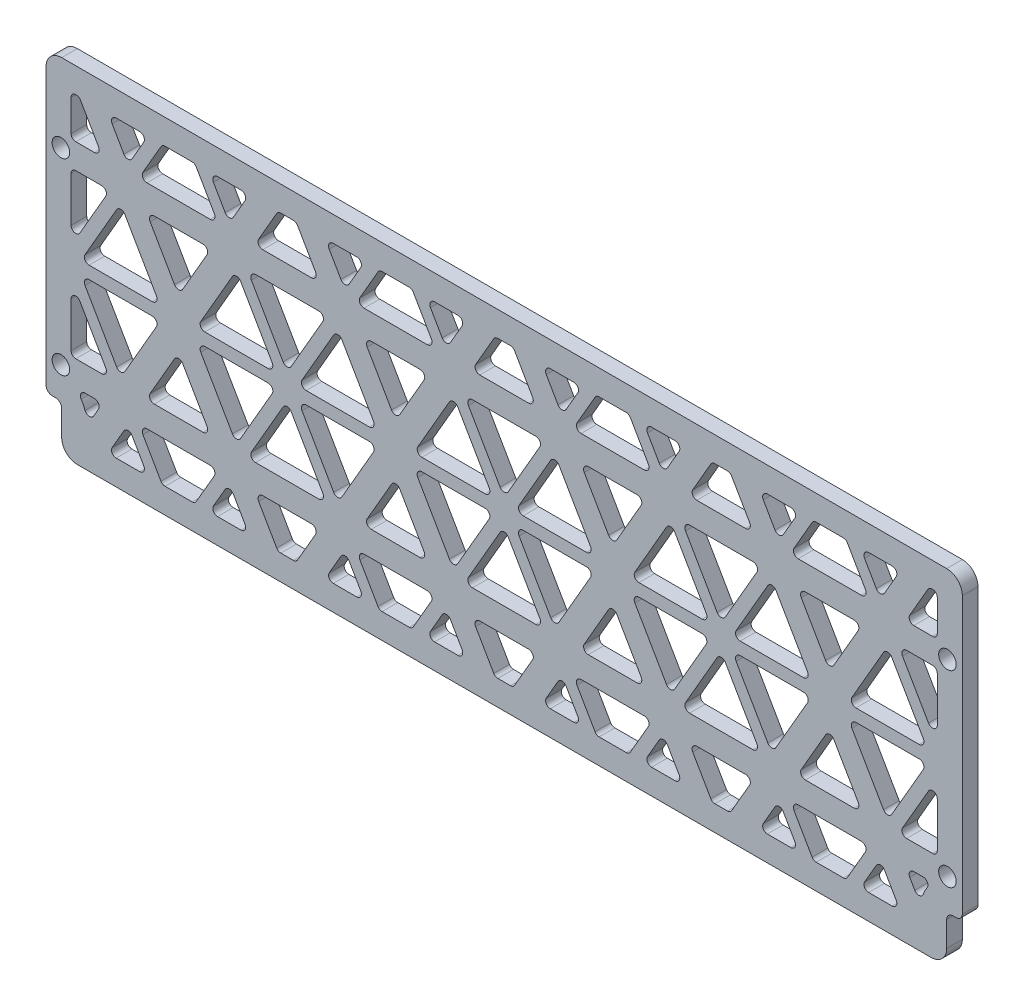
from build123d import *

# Parameters (mm, degrees)
SKETCH1_R           = 3.556
BOSS_EXTRUDE1_DEPTH = 6.35
CUT_EXTRUDE2_DEPTH  = 233.496949241
FILLET1_R           = 1.905


with BuildPart() as part:
    # Sketch1 → Boss-Extrude1 (new body)
    with BuildSketch(Plane.XY):
        with BuildLine():
            Line((-185.7375, 133.35), (-185.7375, 21.59))
            ThreePointArc((-185.7375, 21.59), (-184.993551224, 19.793948776), (-183.1975, 19.05))
            Line((-183.1975, 19.05), (-181.9275, 19.05))
            ThreePointArc((-181.9275, 19.05), (-180.131448776, 18.306051224), (-179.3875, 16.51))
            Line((-179.3875, 16.51), (-179.3875, 6.35))
            ThreePointArc((-179.3875, 6.35), (-177.527628061, 1.859871939), (-173.0375, 0))
            Line((-173.0375, 0), (173.0375, 0))
            ThreePointArc((173.0375, 0), (177.527628061, 1.859871939), (179.3875, 6.35))
            Line((179.3875, 6.35), (179.3875, 16.51))
            ThreePointArc((179.3875, 16.51), (180.131448776, 18.306051224), (181.9275, 19.05))
            Line((181.9275, 19.05), (183.1975, 19.05))
            ThreePointArc((183.1975, 19.05), (184.993551224, 19.793948776), (185.7375, 21.59))
            Line((185.7375, 21.59), (185.7375, 133.35))
            ThreePointArc((185.7375, 133.35), (183.877628061, 137.840128061), (179.3875, 139.7))
            Line((179.3875, 139.7), (-179.3875, 139.7))
            ThreePointArc((-179.3875, 139.7), (-183.877628061, 137.840128061), (-185.7375, 133.35))
        make_face()
        with Locations((-179.705, 31.75)):
            Circle(SKETCH1_R, mode=Mode.SUBTRACT)
        with Locations((-179.705, 107.95)):
            Circle(SKETCH1_R, mode=Mode.SUBTRACT)
        with Locations((179.705, 107.95)):
            Circle(SKETCH1_R, mode=Mode.SUBTRACT)
        with Locations((179.705, 31.75)):
            Circle(SKETCH1_R, mode=Mode.SUBTRACT)
    extrude(amount=BOSS_EXTRUDE1_DEPTH)

    # Sketch4 → Cut-Extrude2 (cut, through all)
    with BuildSketch(Plane.XY.offset(6.35)):
        Polygon((-175.5775, 102.87), (-175.5775, 75.620849334), (-159.845195528, 102.87), align=None)
        Polygon((-155.445786477, 100.33), (-171.576952998, 72.39), (-139.314619955, 72.39), align=None)
        Polygon((-159.845195528, 36.83), (-175.5775, 64.079150666), (-175.5775, 36.83), align=None)
        Polygon((-139.314619955, 67.31), (-171.576952998, 67.31), (-155.445786477, 39.37), align=None)
        Polygon((-175.5775, 129.54), (-175.5775, 113.03), (-162.778134895, 113.03), (-172.31018784, 129.54), align=None)
        Polygon((-118.784044383, 102.87), (-145.18049869, 102.87), (-131.982271537, 80.01), align=None)
        with BuildLine():
            Line((-162.778134895, 26.67), (-174.3075, 26.67))
            ThreePointArc((-174.3075, 26.67), (-170.568274674, 22.189612663), (-169.2275, 16.51))
            Line((-169.2275, 16.51), (-169.2275, 15.499371962))
            Line((-169.2275, 15.499371962), (-162.778134895, 26.67))
        make_face()
        Polygon((-118.784044383, 36.83), (-131.982271537, 59.69), (-145.18049869, 36.83), align=None)
        Polygon((-108.518756597, 100.33), (-124.649923118, 72.39), (-92.387590076, 72.39), align=None)
        Polygon((-92.387590076, 67.31), (-124.649923118, 67.31), (-108.518756597, 39.37), align=None)
        Polygon((-144.447263849, 129.54), (-160.57843037, 129.54), (-152.512847109, 115.57), align=None)
        Polygon((-138.581385114, 129.54), (-148.113438058, 113.03), (-115.851105016, 113.03), (-125.38315796, 129.54), align=None)
        Polygon((-144.447263849, 10.16), (-152.512847109, 24.13), (-160.57843037, 10.16), align=None)
        Polygon((-115.851105016, 26.67), (-148.113438058, 26.67), (-138.581385114, 10.16), (-125.38315796, 10.16), align=None)
        Polygon((-71.857014503, 102.87), (-104.119347546, 102.87), (-87.988181024, 74.93), align=None)
        Polygon((-119.517279225, 129.54), (-111.451695964, 115.57), (-103.386112704, 129.54), align=None)
        Polygon((-103.386112704, 10.16), (-111.451695964, 24.13), (-119.517279225, 10.16), align=None)
        Polygon((-87.988181024, 64.77), (-104.119347546, 36.83), (-71.857014503, 36.83), align=None)
        Polygon((-91.654355234, 129.54), (-101.186408178, 113.03), (-74.789953871, 113.03), (-84.322006815, 129.54), align=None)
        Polygon((-67.457605452, 100.33), (-83.588771973, 72.39), (-51.326438931, 72.39), align=None)
        Polygon((-74.789953871, 26.67), (-101.186408178, 26.67), (-91.654355234, 10.16), (-84.322006815, 10.16), align=None)
        Polygon((-51.326438931, 67.31), (-83.588771973, 67.31), (-67.457605452, 39.37), align=None)
        Polygon((-30.795863359, 102.87), (-57.192317666, 102.87), (-43.994090512, 80.01), align=None)
        Polygon((-56.459082824, 129.54), (-72.590249345, 129.54), (-64.524666085, 115.57), align=None)
        Polygon((-56.459082824, 10.16), (-64.524666085, 24.13), (-72.590249345, 10.16), align=None)
        Polygon((-43.994090512, 59.69), (-57.192317666, 36.83), (-30.795863359, 36.83), align=None)
        Polygon((-50.593204089, 129.54), (-60.125257033, 113.03), (-27.862923991, 113.03), (-37.394976935, 129.54), align=None)
        Polygon((-20.530575572, 100.33), (-36.661742094, 72.39), (-4.399409051, 72.39), align=None)
        Polygon((-27.862923991, 26.67), (-60.125257033, 26.67), (-50.593204089, 10.16), (-37.394976935, 10.16), align=None)
        Polygon((-4.399409051, 67.31), (-36.661742094, 67.31), (-20.530575572, 39.37), align=None)
        Polygon((-15.397931679, 129.54), (-31.5290982, 129.54), (-23.46351494, 115.57), align=None)
        Polygon((-23.46351494, 24.13), (-31.5290982, 10.16), (-15.397931679, 10.16), align=None)
        Polygon((16.131166521, 102.87), (-16.131166521, 102.87), (0, 74.93), align=None)
        Polygon((0, 64.77), (-16.131166521, 36.83), (16.131166521, 36.83), align=None)
        Polygon((-3.666174209, 129.54), (-13.198227154, 113.03), (13.198227154, 113.03), (3.666174209, 129.54), align=None)
        Polygon((20.530575572, 100.33), (4.399409051, 72.39), (36.661742094, 72.39), align=None)
        Polygon((13.198227154, 26.67), (-13.198227154, 26.67), (-3.666174209, 10.16), (3.666174209, 10.16), align=None)
        Polygon((36.661742094, 67.31), (4.399409051, 67.31), (20.530575572, 39.37), align=None)
        Polygon((31.5290982, 129.54), (15.397931679, 129.54), (23.46351494, 115.57), align=None)
        Polygon((23.46351494, 24.13), (15.397931679, 10.16), (31.5290982, 10.16), align=None)
        Polygon((57.192317666, 102.87), (30.795863359, 102.87), (43.994090512, 80.01), align=None)
        Polygon((43.994090512, 59.69), (30.795863359, 36.83), (57.192317666, 36.83), align=None)
        Polygon((37.394976935, 129.54), (27.862923991, 113.03), (60.125257033, 113.03), (50.593204089, 129.54), align=None)
        Polygon((67.457605452, 100.33), (51.326438931, 72.39), (83.588771973, 72.39), align=None)
        Polygon((60.125257033, 26.67), (27.862923991, 26.67), (37.394976935, 10.16), (50.593204089, 10.16), align=None)
        Polygon((83.588771973, 67.31), (51.326438931, 67.31), (67.457605452, 39.37), align=None)
        Polygon((72.590249345, 129.54), (56.459082824, 129.54), (64.524666085, 115.57), align=None)
        Polygon((64.524666085, 24.13), (56.459082824, 10.16), (72.590249345, 10.16), align=None)
        Polygon((104.119347546, 102.87), (71.857014503, 102.87), (87.988181024, 74.93), align=None)
        Polygon((91.654355234, 129.54), (84.322006815, 129.54), (74.789953871, 113.03), (101.186408178, 113.03), align=None)
        Polygon((74.789953871, 26.67), (84.322006815, 10.16), (91.654355234, 10.16), (101.186408178, 26.67), align=None)
        Polygon((87.988181024, 64.77), (71.857014503, 36.83), (104.119347546, 36.83), align=None)
        Polygon((108.518756597, 100.33), (92.387590076, 72.39), (124.649923118, 72.39), align=None)
        Polygon((124.649923118, 67.31), (92.387590076, 67.31), (108.518756597, 39.37), align=None)
        Polygon((119.517279225, 129.54), (103.386112704, 129.54), (111.451695964, 115.57), align=None)
        Polygon((111.451695964, 24.13), (103.386112704, 10.16), (119.517279225, 10.16), align=None)
        Polygon((145.18049869, 102.87), (118.784044383, 102.87), (131.982271537, 80.01), align=None)
        Polygon((138.581385114, 129.54), (125.38315796, 129.54), (115.851105016, 113.03), (148.113438058, 113.03), align=None)
        Polygon((115.851105016, 26.67), (125.38315796, 10.16), (138.581385114, 10.16), (148.113438058, 26.67), align=None)
        Polygon((131.982271537, 59.69), (118.784044383, 36.83), (145.18049869, 36.83), align=None)
        Polygon((160.57843037, 129.54), (144.447263849, 129.54), (152.512847109, 115.57), align=None)
        Polygon((155.445786477, 100.33), (139.314619955, 72.39), (171.576952998, 72.39), align=None)
        Polygon((152.512847109, 24.13), (144.447263849, 10.16), (160.57843037, 10.16), align=None)
        Polygon((171.576952998, 67.31), (139.314619955, 67.31), (155.445786477, 39.37), align=None)
        Polygon((175.5775, 129.54), (172.31018784, 129.54), (162.778134895, 113.03), (175.5775, 113.03), align=None)
        Polygon((175.5775, 102.87), (159.845195528, 102.87), (175.5775, 75.620849334), align=None)
        with BuildLine():
            Line((162.778134895, 26.67), (169.2275, 15.499371962))
            Line((169.2275, 15.499371962), (169.2275, 16.51))
            ThreePointArc((169.2275, 16.51), (170.568274674, 22.189612663), (174.3075, 26.67))
            Line((174.3075, 26.67), (162.778134895, 26.67))
        make_face()
        Polygon((175.5775, 64.079150666), (159.845195528, 36.83), (175.5775, 36.83), align=None)
    extrude(amount=-CUT_EXTRUDE2_DEPTH, mode=Mode.SUBTRACT)

    # Fillet1
    fillet1_edges = [part.edges().sort_by_distance(p)[0] for p in [
        (169.2275, 15.499371962, 3.175),
        (-169.2275, 15.499371962, 3.175),
        (175.5775, 64.079150666, 3.175),
        (-175.5775, 64.079150666, 3.175),
        (-152.512847109, 24.13, 3.175),
        (-111.451695964, 24.13, 3.175),
        (-64.524666085, 24.13, 3.175),
        (-23.46351494, 24.13, 3.175),
        (152.512847109, 24.13, 3.175),
        (111.451695964, 24.13, 3.175),
        (64.524666085, 24.13, 3.175),
        (23.46351494, 24.13, 3.175),
        (144.447263849, 10.16, 3.175),
        (125.38315796, 10.16, 3.175),
        (103.386112704, 10.16, 3.175),
        (56.459082824, 10.16, 3.175),
        (84.322006815, 10.16, 3.175),
        (37.394976935, 10.16, 3.175),
        (15.397931679, 10.16, 3.175),
        (-3.666174209, 10.16, 3.175),
        (-31.5290982, 10.16, 3.175),
        (-50.593204089, 10.16, 3.175),
        (-72.590249345, 10.16, 3.175),
        (-91.654355234, 10.16, 3.175),
        (-119.517279225, 10.16, 3.175),
        (-138.581385114, 10.16, 3.175),
        (-160.57843037, 10.16, 3.175),
        (139.314619955, 72.39, 3.175),
        (92.387590076, 72.39, 3.175),
        (51.326438931, 72.39, 3.175),
        (4.399409051, 72.39, 3.175),
        (-36.661742094, 72.39, 3.175),
        (-83.588771973, 72.39, 3.175),
        (-124.649923118, 72.39, 3.175),
        (-171.576952998, 72.39, 3.175),
        (159.845195528, 36.83, 3.175),
        (118.784044383, 36.83, 3.175),
        (71.857014503, 36.83, 3.175),
        (30.795863359, 36.83, 3.175),
        (-16.131166521, 36.83, 3.175),
        (-57.192317666, 36.83, 3.175),
        (-104.119347546, 36.83, 3.175),
        (-145.18049869, 36.83, 3.175),
        (-144.447263849, 10.16, 3.175),
        (-125.38315796, 10.16, 3.175),
        (-103.386112704, 10.16, 3.175),
        (-84.322006815, 10.16, 3.175),
        (-56.459082824, 10.16, 3.175),
        (-37.394976935, 10.16, 3.175),
        (-15.397931679, 10.16, 3.175),
        (3.666174209, 10.16, 3.175),
        (31.5290982, 10.16, 3.175),
        (50.593204089, 10.16, 3.175),
        (72.590249345, 10.16, 3.175),
        (91.654355234, 10.16, 3.175),
        (119.517279225, 10.16, 3.175),
        (138.581385114, 10.16, 3.175),
        (160.57843037, 10.16, 3.175),
        (-159.845195528, 36.83, 3.175),
        (-118.784044383, 36.83, 3.175),
        (-71.857014503, 36.83, 3.175),
        (-30.795863359, 36.83, 3.175),
        (16.131166521, 36.83, 3.175),
        (57.192317666, 36.83, 3.175),
        (104.119347546, 36.83, 3.175),
        (145.18049869, 36.83, 3.175),
        (-4.399409051, 72.39, 3.175),
        (36.661742094, 72.39, 3.175),
        (83.588771973, 72.39, 3.175),
        (124.649923118, 72.39, 3.175),
        (171.576952998, 72.39, 3.175),
        (-51.326438931, 72.39, 3.175),
        (-92.387590076, 72.39, 3.175),
        (-139.314619955, 72.39, 3.175),
        (-155.445786477, 100.33, 3.175),
        (-131.982271537, 59.69, 3.175),
        (-108.518756597, 100.33, 3.175),
        (-87.988181024, 64.77, 3.175),
        (-67.457605452, 100.33, 3.175),
        (-43.994090512, 59.69, 3.175),
        (-20.530575572, 100.33, 3.175),
        (20.530575572, 100.33, 3.175),
        (67.457605452, 100.33, 3.175),
        (0, 64.77, 3.175),
        (43.994090512, 59.69, 3.175),
        (87.988181024, 64.77, 3.175),
        (131.982271537, 59.69, 3.175),
        (108.518756597, 100.33, 3.175),
        (155.445786477, 100.33, 3.175),
        (175.5775, 36.83, 3.175),
        (-175.5775, 36.83, 3.175),
        (-175.5775, 75.620849334, 3.175),
        (-131.982271537, 80.01, 3.175),
        (-87.988181024, 74.93, 3.175),
        (-43.994090512, 80.01, 3.175),
        (0, 74.93, 3.175),
        (175.5775, 75.620849334, 3.175),
        (131.982271537, 80.01, 3.175),
        (87.988181024, 74.93, 3.175),
        (43.994090512, 80.01, 3.175),
        (155.445786477, 39.37, 3.175),
        (108.518756597, 39.37, 3.175),
        (67.457605452, 39.37, 3.175),
        (20.530575572, 39.37, 3.175),
        (-20.530575572, 39.37, 3.175),
        (-67.457605452, 39.37, 3.175),
        (-108.518756597, 39.37, 3.175),
        (-155.445786477, 39.37, 3.175),
        (-162.778134895, 26.67, 3.175),
        (162.778134895, 26.67, 3.175),
        (174.3075, 26.67, 3.175),
        (148.113438058, 26.67, 3.175),
        (101.186408178, 26.67, 3.175),
        (60.125257033, 26.67, 3.175),
        (13.198227154, 26.67, 3.175),
        (-27.862923991, 26.67, 3.175),
        (-74.789953871, 26.67, 3.175),
        (-115.851105016, 26.67, 3.175),
        (-139.314619955, 67.31, 3.175),
        (-92.387590076, 67.31, 3.175),
        (-51.326438931, 67.31, 3.175),
        (-4.399409051, 67.31, 3.175),
        (36.661742094, 67.31, 3.175),
        (83.588771973, 67.31, 3.175),
        (124.649923118, 67.31, 3.175),
        (171.576952998, 67.31, 3.175),
        (175.5775, 102.87, 3.175),
        (145.18049869, 102.87, 3.175),
        (104.119347546, 102.87, 3.175),
        (57.192317666, 102.87, 3.175),
        (16.131166521, 102.87, 3.175),
        (-30.795863359, 102.87, 3.175),
        (-71.857014503, 102.87, 3.175),
        (-118.784044383, 102.87, 3.175),
        (-159.845195528, 102.87, 3.175),
        (-174.3075, 26.67, 3.175),
        (-148.113438058, 26.67, 3.175),
        (-101.186408178, 26.67, 3.175),
        (-60.125257033, 26.67, 3.175),
        (-13.198227154, 26.67, 3.175),
        (27.862923991, 26.67, 3.175),
        (74.789953871, 26.67, 3.175),
        (115.851105016, 26.67, 3.175),
        (139.314619955, 67.31, 3.175),
        (92.387590076, 67.31, 3.175),
        (51.326438931, 67.31, 3.175),
        (4.399409051, 67.31, 3.175),
        (-36.661742094, 67.31, 3.175),
        (-83.588771973, 67.31, 3.175),
        (-124.649923118, 67.31, 3.175),
        (-171.576952998, 67.31, 3.175),
        (159.845195528, 102.87, 3.175),
        (118.784044383, 102.87, 3.175),
        (71.857014503, 102.87, 3.175),
        (30.795863359, 102.87, 3.175),
        (-16.131166521, 102.87, 3.175),
        (-57.192317666, 102.87, 3.175),
        (-104.119347546, 102.87, 3.175),
        (-145.18049869, 102.87, 3.175),
        (-175.5775, 102.87, 3.175),
        (162.778134895, 113.03, 3.175),
        (175.5775, 113.03, 3.175),
        (175.5775, 129.54, 3.175),
        (172.31018784, 129.54, 3.175),
        (144.447263849, 129.54, 3.175),
        (160.57843037, 129.54, 3.175),
        (152.512847109, 115.57, 3.175),
        (115.851105016, 113.03, 3.175),
        (148.113438058, 113.03, 3.175),
        (138.581385114, 129.54, 3.175),
        (125.38315796, 129.54, 3.175),
        (103.386112704, 129.54, 3.175),
        (119.517279225, 129.54, 3.175),
        (111.451695964, 115.57, 3.175),
        (74.789953871, 113.03, 3.175),
        (101.186408178, 113.03, 3.175),
        (91.654355234, 129.54, 3.175),
        (84.322006815, 129.54, 3.175),
        (56.459082824, 129.54, 3.175),
        (72.590249345, 129.54, 3.175),
        (64.524666085, 115.57, 3.175),
        (27.862923991, 113.03, 3.175),
        (60.125257033, 113.03, 3.175),
        (50.593204089, 129.54, 3.175),
        (37.394976935, 129.54, 3.175),
        (15.397931679, 129.54, 3.175),
        (31.5290982, 129.54, 3.175),
        (23.46351494, 115.57, 3.175),
        (-13.198227154, 113.03, 3.175),
        (13.198227154, 113.03, 3.175),
        (-3.666174209, 129.54, 3.175),
        (3.666174209, 129.54, 3.175),
        (-31.5290982, 129.54, 3.175),
        (-15.397931679, 129.54, 3.175),
        (-23.46351494, 115.57, 3.175),
        (-60.125257033, 113.03, 3.175),
        (-27.862923991, 113.03, 3.175),
        (-50.593204089, 129.54, 3.175),
        (-37.394976935, 129.54, 3.175),
        (-64.524666085, 115.57, 3.175),
        (-72.590249345, 129.54, 3.175),
        (-56.459082824, 129.54, 3.175),
        (-101.186408178, 113.03, 3.175),
        (-91.654355234, 129.54, 3.175),
        (-84.322006815, 129.54, 3.175),
        (-74.789953871, 113.03, 3.175),
        (-111.451695964, 115.57, 3.175),
        (-119.517279225, 129.54, 3.175),
        (-103.386112704, 129.54, 3.175),
        (-115.851105016, 113.03, 3.175),
        (-148.113438058, 113.03, 3.175),
        (-138.581385114, 129.54, 3.175),
        (-125.38315796, 129.54, 3.175),
        (-152.512847109, 115.57, 3.175),
        (-160.57843037, 129.54, 3.175),
        (-144.447263849, 129.54, 3.175),
        (-162.778134895, 113.03, 3.175),
        (-175.5775, 113.03, 3.175),
        (-172.31018784, 129.54, 3.175),
        (-175.5775, 129.54, 3.175),
    ]]
    fillet(fillet1_edges, radius=FILLET1_R)


solid = part.part
